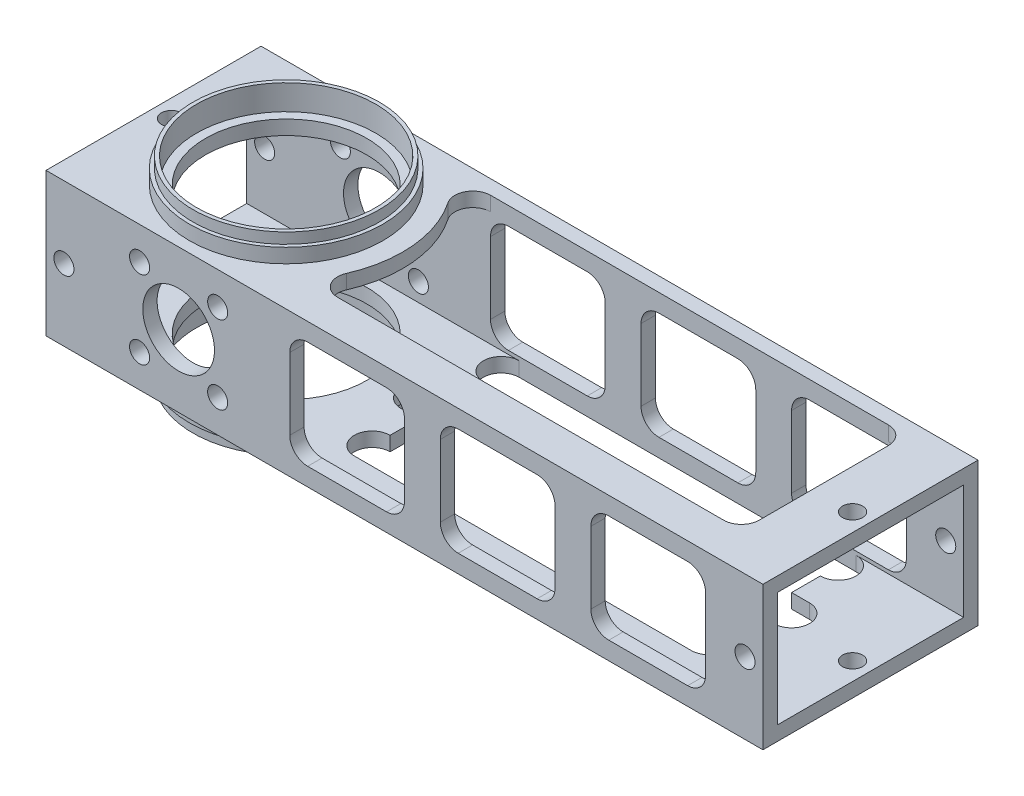
from build123d import *

# Parameters (mm, degrees)
SKETCH1_W                            = 38.1
SKETCH1_H                            = 25.4
SKETCH1_W_2                          = 33.02
SKETCH1_H_2                          = 20.32
BOSS_EXTRUDE1_DEPTH                  = 127
SKETCH2_R                            = 14.2875
CUT_EXTRUDE1_DEPTH                   = 136.002851822
SKETCH3_R                            = 6.35
SKETCH3_R_2                          = 1.778
CUT_EXTRUDE2_DEPTH                   = 136.002851822
CUT_EXTRUDE3_REACH                   = 137.003
F_4_0_209_DIAMETER_HOLE1_D           = 3.556
F_4_0_209_DIAMETER_HOLE1_ON_FACE_2_D = 3.556
F_4_0_209_DIAMETER_HOLE1_ON_FACE_3_D = 3.556
F_4_0_209_DIAMETER_HOLE1_ON_FACE_4_D = 3.556
CUT_EXTRUDE4_REACH                   = 137.003


with BuildPart() as part:
    # Sketch1 → Boss-Extrude1 (new body)
    with BuildSketch(Plane(origin=(0, 0, 0), x_dir=(0, 0, -1), z_dir=(1, 0, 0))):
        with Locations((19.05, 12.7)):
            Rectangle(SKETCH1_W, SKETCH1_H)
        with Locations((19.05, 12.7)):
            Rectangle(SKETCH1_W_2, SKETCH1_H_2, mode=Mode.SUBTRACT)
    extrude(amount=BOSS_EXTRUDE1_DEPTH)

    # Sketch2 → Cut-Extrude1 (cut, through all)
    with BuildSketch(Plane(origin=(0, 25.4, 0), x_dir=(1, 0, 0), z_dir=(0, 1, 0))):
        with Locations((23.495, 19.05)):
            Circle(SKETCH2_R)
    extrude(amount=-CUT_EXTRUDE1_DEPTH, mode=Mode.SUBTRACT)

    # Sketch3 → Cut-Extrude2 (cut, through all)
    with BuildSketch(Plane.XY):
        with Locations((23.495, 12.7)):
            Circle(SKETCH3_R)
        with Locations((16.580202787, 19.614797213)):
            Circle(SKETCH3_R_2)
        with Locations((16.580202787, 5.785202787)):
            Circle(SKETCH3_R_2)
        with Locations((30.409797213, 5.785202787)):
            Circle(SKETCH3_R_2)
        with Locations((30.409797213, 19.614797213)):
            Circle(SKETCH3_R_2)
        with BuildLine():
            Line((46.355, 22.225), (60.325, 22.225))
            ThreePointArc((60.325, 22.225), (62.57006403, 21.29506403), (63.5, 19.05))
            Line((63.5, 19.05), (63.5, 6.35))
            ThreePointArc((63.5, 6.35), (62.57006403, 4.10493597), (60.325, 3.175))
            Line((60.325, 3.175), (46.355, 3.175))
            ThreePointArc((46.355, 3.175), (44.10993597, 4.10493597), (43.18, 6.35))
            Line((43.18, 6.35), (43.18, 19.05))
            ThreePointArc((43.18, 19.05), (44.10993597, 21.29506403), (46.355, 22.225))
        make_face()
        with BuildLine():
            Line((73.025, 22.225), (86.995, 22.225))
            ThreePointArc((86.995, 22.225), (89.24006403, 21.29506403), (90.17, 19.05))
            Line((90.17, 19.05), (90.17, 6.35))
            ThreePointArc((90.17, 6.35), (89.24006403, 4.10493597), (86.995, 3.175))
            Line((86.995, 3.175), (73.025, 3.175))
            ThreePointArc((73.025, 3.175), (70.77993597, 4.10493597), (69.85, 6.35))
            Line((69.85, 6.35), (69.85, 19.05))
            ThreePointArc((69.85, 19.05), (70.77993597, 21.29506403), (73.025, 22.225))
        make_face()
        with BuildLine():
            Line((99.695, 22.225), (113.665, 22.225))
            ThreePointArc((113.665, 22.225), (115.91006403, 21.29506403), (116.84, 19.05))
            Line((116.84, 19.05), (116.84, 6.35))
            ThreePointArc((116.84, 6.35), (115.91006403, 4.10493597), (113.665, 3.175))
            Line((113.665, 3.175), (99.695, 3.175))
            ThreePointArc((99.695, 3.175), (97.44993597, 4.10493597), (96.52, 6.35))
            Line((96.52, 6.35), (96.52, 19.05))
            ThreePointArc((96.52, 19.05), (97.44993597, 21.29506403), (99.695, 22.225))
        make_face()
    extrude(amount=-CUT_EXTRUDE2_DEPTH, mode=Mode.SUBTRACT)

    # Sketch4 → Cut-Extrude3 (cut, up to next)
    with BuildSketch(Plane(origin=(0, 25.4, 0), x_dir=(1, 0, 0), z_dir=(0, 1, 0)), mode=Mode.PRIVATE) as cut_extrude3_sk1:
        with BuildLine():
            Line((45.319516747, 6.35), (113.665, 6.35))
            ThreePointArc((113.665, 6.35), (115.91006403, 7.27993597), (116.84, 9.525))
            Line((116.84, 9.525), (116.84, 32.385))
            ThreePointArc((116.84, 32.385), (115.91006403, 34.63006403), (113.665, 35.56))
            Line((113.665, 35.56), (43.223480206, 35.56))
            ThreePointArc((43.223480206, 35.56), (40.419396131, 33.874207004), (40.593016179, 30.607))
            ThreePointArc((40.593016179, 30.607), (44.046292615, 20.934350844), (42.409581181, 10.795))
            ThreePointArc((42.409581181, 10.795), (42.663121163, 7.78598088), (45.319516747, 6.35))
        make_face()
    cut_extrude3_tool1 = extrude(cut_extrude3_sk1.sketch, amount=-CUT_EXTRUDE3_REACH, mode=Mode.PRIVATE) & part.part
    add(cut_extrude3_tool1.solids().sort_by_distance((79.681448, 25.4, -21.040871))[0], mode=Mode.SUBTRACT)

    # #4 (0.209) Diameter Hole1 (through all)
    with Locations(Plane(origin=(3.175, 25.4, -19.05), x_dir=(0, 0, 1), z_dir=(0, 1, 0))):
        with Locations((0, 0), (0, 120.65)):
            Hole(F_4_0_209_DIAMETER_HOLE1_D / 2)

    # #4 (0.209) Diameter Hole1 on face 2 (through all)
    with Locations(Plane(origin=(123.825, 12.7, 0), x_dir=(1, 0, 0), z_dir=(0, 0, 1))):
        with Locations((0, 0), (-120.65, 0)):
            Hole(F_4_0_209_DIAMETER_HOLE1_ON_FACE_2_D / 2)

    # #4 (0.209) Diameter Hole1 on face 3 (through all)
    with Locations(Plane(origin=(123.825, 0, -19.05), x_dir=(0, 0, -1), z_dir=(0, -1, 0))):
        with Locations((0, 0), (0, -120.65)):
            Hole(F_4_0_209_DIAMETER_HOLE1_ON_FACE_3_D / 2)

    # #4 (0.209) Diameter Hole1 on face 4 (through all)
    with Locations(Plane(origin=(123.825, 12.7, -38.1), x_dir=(-1, 0, 0), z_dir=(0, 0, -1))):
        with Locations((0, 0), (120.65, 0)):
            Hole(F_4_0_209_DIAMETER_HOLE1_ON_FACE_4_D / 2)

    # Sketch6 → Cut-Extrude4 (cut, up to next)
    with BuildSketch(Plane.XZ, mode=Mode.PRIVATE) as cut_extrude4_sk1:
        with BuildLine():
            Line((48.26, -35.56), (107.95, -35.56))
            ThreePointArc((107.95, -35.56), (111.125, -32.385), (107.95, -29.21))
            Line((107.95, -29.21), (107.95, -24.13))
            Line((107.95, -24.13), (111.125, -24.13))
            ThreePointArc((111.125, -24.13), (114.3, -20.955), (111.125, -17.78))
            Line((111.125, -17.78), (107.95, -17.78))
            Line((107.95, -17.78), (107.95, -12.7))
            ThreePointArc((107.95, -12.7), (111.125, -9.525), (107.95, -6.35))
            Line((107.95, -6.35), (48.26, -6.35))
            ThreePointArc((48.26, -6.35), (45.085, -9.525), (48.26, -12.7))
            Line((48.26, -12.7), (48.26, -17.78))
            Line((48.26, -17.78), (45.085, -17.78))
            ThreePointArc((45.085, -17.78), (41.91, -20.955), (45.085, -24.13))
            Line((45.085, -24.13), (48.26, -24.13))
            Line((48.26, -24.13), (48.26, -29.21))
            ThreePointArc((48.26, -29.21), (45.085, -32.385), (48.26, -35.56))
        make_face()
    cut_extrude4_tool1 = extrude(cut_extrude4_sk1.sketch, amount=-CUT_EXTRUDE4_REACH, mode=Mode.PRIVATE) & part.part
    add(cut_extrude4_tool1.solids().sort_by_distance((78.105, 0, -20.955))[0], mode=Mode.SUBTRACT)

    # Sketch7 → Revolve1 (revolve)
    with BuildSketch(Plane.XY.offset(-19.05)):
        Polygon((39.37, 29.845), (39.37, 25.4), (40.64, 25.4), (40.64, 27.94), (40.005, 27.94), (40.005, 29.845), align=None)
        Polygon((39.37, -4.445), (39.37, 0), (40.64, 0), (40.64, -2.54), (40.005, -2.54), (40.005, -4.445), align=None)
    revolve(axis=Axis((23.495, -4.445, -19.05), (0, 1, 0)))


solid = part.part
